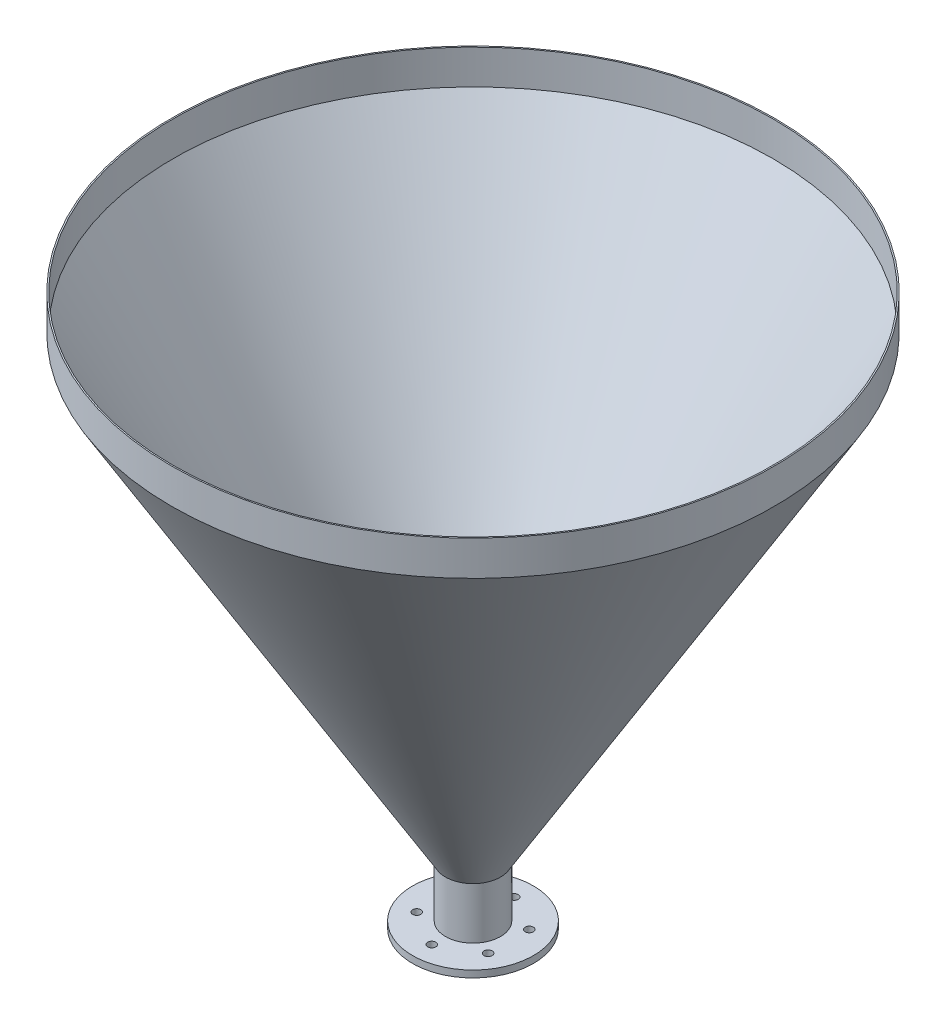
from build123d import *

# Parameters (mm, degrees)
CROQUIS1_R              = 219.5
SALIENTE_EXTRUIR1_DEPTH = 25.4
CROQUIS3_R              = 20
CROQUIS2_R              = 219.5
CROQUIS4_R              = 20
SALIENTE_EXTRUIR2_DEPTH = 40
CROQUIS10_R             = 44
SALIENTE_EXTRUIR6_DEPTH = 2.5
CROQUIS15_R             = 19
CORTAR_EXTRUIR1_DEPTH   = 504.560075947
CROQUIS16_R             = 3
CORTAR_EXTRUIR2_DEPTH   = 5


# Read off the part's stored shape, not the designer's step: Vaciado3
with BuildPart() as part:
    # Croquis1 → Saliente-Extruir1 (new body)
    with BuildSketch(Plane(origin=(0, 0, 0), x_dir=(1, 0, 0), z_dir=(0, 1, 0))):
        with Locations(Location((0, 0, 0), (0, 0, 270))):
            Circle(CROQUIS1_R)
    extrude(amount=-SALIENTE_EXTRUIR1_DEPTH)

    # Croquis3 → Recubrir1 section 0
    with BuildSketch(Plane(origin=(0, -359, 0), x_dir=(1, 0, 0), z_dir=(0, 1, 0))):
        Circle(CROQUIS3_R)
    # Croquis2 → Recubrir1 section 1
    with BuildSketch(Plane.XZ.offset(25.4)):
        Circle(CROQUIS2_R)
    loft()

    # Croquis4 → Saliente-Extruir2 (add)
    with BuildSketch(Plane.XZ.offset(359)):
        with Locations(Location((0, 0, 0), (0, 0, 270))):
            Circle(CROQUIS4_R)
    extrude(amount=SALIENTE_EXTRUIR2_DEPTH)

    # Vaciado3 outline → Vaciado3 (revolve, cut)
    with BuildSketch(Plane.XY):
        Polygon((218.5, -25.123799723), (218.5, 0), (0, 0), (0, -399), (19, -399), (19, -358.723799723), align=None)
    revolve(axis=Axis((0, 0, 0), (0, 1, 0)), mode=Mode.SUBTRACT)

    # Croquis10 → Saliente-Extruir6 (add, symmetric)
    with BuildSketch(Plane.XZ.offset(399)):
        with Locations(Location((0, 0, 0), (0, 0, 270))):
            Circle(CROQUIS10_R)
    extrude(amount=SALIENTE_EXTRUIR6_DEPTH, both=True)

    # Croquis15 → Cortar-Extruir1 (cut, through all)
    with BuildSketch(Plane(origin=(0, -396.5, 0), x_dir=(1, 0, 0), z_dir=(0, 1, 0))):
        with Locations(Location((0, 0, 0), (0, 0, 270))):
            Circle(CROQUIS15_R)
    extrude(amount=-CORTAR_EXTRUIR1_DEPTH, mode=Mode.SUBTRACT)

    # Croquis16 → Cortar-Extruir2 (cut)
    with BuildSketch(Plane.XZ.offset(401.5)):
        with Locations(Location((0, -30, 0), (0, 0, 270))):
            Circle(CROQUIS16_R)
        with Locations(Location((-25.980762114, -15, 0), (0, 0, 270))):
            Circle(CROQUIS16_R)
        with Locations(Location((-25.980762114, 15, 0), (0, 0, 270))):
            Circle(CROQUIS16_R)
        with Locations(Location((0, 30, 0), (0, 0, 270))):
            Circle(CROQUIS16_R)
        with Locations(Location((25.980762114, 15, 0), (0, 0, 270))):
            Circle(CROQUIS16_R)
        with Locations(Location((25.980762114, -15, 0), (0, 0, 270))):
            Circle(CROQUIS16_R)
    extrude(amount=-CORTAR_EXTRUIR2_DEPTH, mode=Mode.SUBTRACT)


solid = part.part
